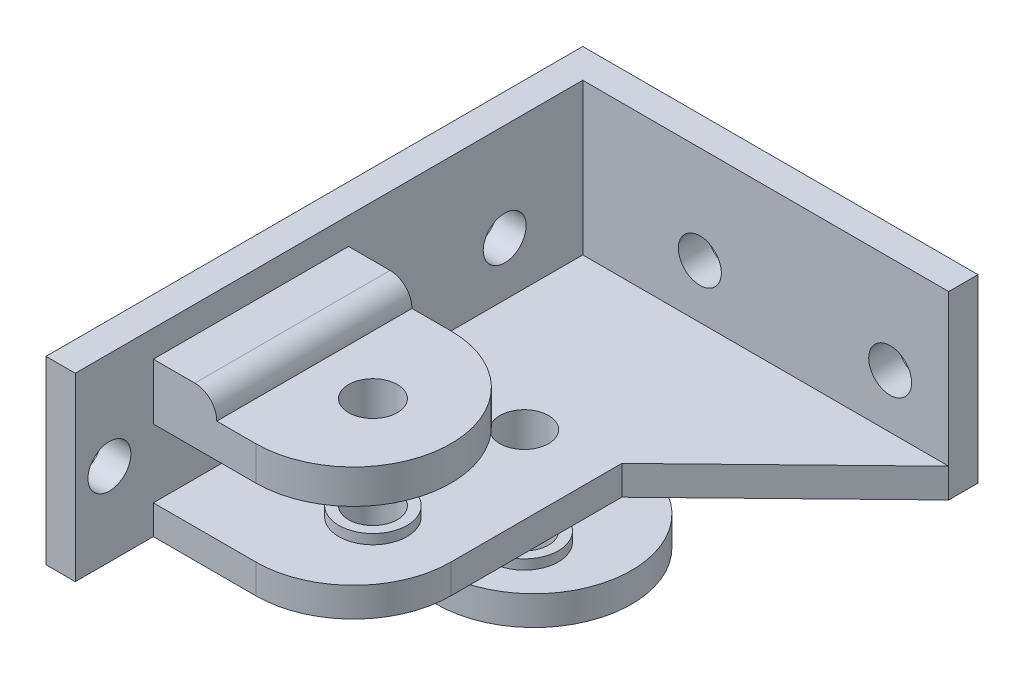
from build123d import *

# Parameters (mm, degrees)
BOSS_EXTRUDE1_DEPTH = 18.5
BOSS_EXTRUDE2_DEPTH = 3
BOSS_EXTRUDE3_START = 7
BOSS_EXTRUDE3_DEPTH = 3.5
SKETCH4_W           = 6.5
SKETCH4_H           = 2.25
BOSS_EXTRUDE4_DEPTH = 20
FILLET1_R           = 2.25
BOSS_EXTRUDE5_DEPTH = 7
BOSS_EXTRUDE6_DEPTH = 3
SKETCH7_R           = 2.5
CUT_EXTRUDE1_DEPTH  = 73.232264259
SKETCH8_R           = 2.2
CUT_EXTRUDE2_DEPTH  = 71.763691255
CUT_EXTRUDE3_REACH  = 72.764
SKETCH9_R           = 2.2
BOSS_EXTRUDE7_REACH = 74.907
SKETCH10_R          = 3.5
SKETCH10_R_2        = 2.5
BOSS_EXTRUDE8_REACH = 72.039
SKETCH11_R          = 3.5
SKETCH11_R_2        = 2.5
CUT_EXTRUDE4_REACH  = 66.742
SKETCH12_W          = 7
SKETCH12_H          = 5


with BuildPart() as part:
    # Sketch1 → Boss-Extrude1 (new body)
    with BuildSketch(Plane(origin=(0, 0, 0), x_dir=(1, 0, 0), z_dir=(0, 1, 0))):
        Polygon((40.5, 0), (0, 0), (0, -55), (3, -55), (3, -3), (40.5, -3), align=None)
    extrude(amount=BOSS_EXTRUDE1_DEPTH)

    # Sketch2 → Boss-Extrude2 (add)
    with BuildSketch(Plane.XZ):
        with BuildLine():
            Line((40.5, 3), (23.5, 19.5))
            Line((23.5, 19.5), (23.5, 37))
            ThreePointArc((23.5, 37), (20.571067812, 44.071067812), (13.5, 47))
            Line((13.5, 47), (3, 47))
            Line((3, 47), (3, 3))
            Line((3, 3), (40.5, 3))
        make_face()
    extrude(amount=-BOSS_EXTRUDE2_DEPTH)

    # Sketch3 → Boss-Extrude3 (add)
    with BuildSketch(Plane(origin=(0, 3, 0), x_dir=(1, 0, 0), z_dir=(0, 1, 0)).offset(BOSS_EXTRUDE3_START)):
        with BuildLine():
            Line((3, -47), (13.5, -47))
            ThreePointArc((13.5, -47), (23.5, -37), (13.5, -27))
            Line((13.5, -27), (3, -27))
            Line((3, -27), (3, -47))
        make_face()
    extrude(amount=BOSS_EXTRUDE3_DEPTH)

    # Sketch4 → Boss-Extrude4 (add)
    with BuildSketch(Plane.XY.offset(47)):
        with Locations((6.25, 14.625)):
            Rectangle(SKETCH4_W, SKETCH4_H)
    extrude(amount=-BOSS_EXTRUDE4_DEPTH)

    # Fillet1
    fillet1_edges = [part.edges().sort_by_distance(p)[0] for p in [
        (9.5, 15.75, 37),
    ]]
    fillet(fillet1_edges, radius=FILLET1_R - 0.0001)  # a hair under: the kernel refuses the full size

    # Sketch5 → Boss-Extrude5 (add)
    with BuildSketch(Plane.XZ):
        Polygon((0, 28.5), (0, 8.5), (9, 8.5), (9, 10.5), (3, 10.5), (3, 28.5), align=None)
    extrude(amount=BOSS_EXTRUDE5_DEPTH)

    # Sketch6 → Boss-Extrude6 (add)
    with BuildSketch(Plane.XZ.offset(7)):
        with BuildLine():
            Line((0, 8.5), (0, 28.5))
            Line((0, 28.5), (13.5, 28.5))
            ThreePointArc((13.5, 28.5), (23.5, 18.5), (13.5, 8.5))
            Line((13.5, 8.5), (0, 8.5))
        make_face()
    extrude(amount=BOSS_EXTRUDE6_DEPTH)

    # Sketch7 → Cut-Extrude1 (cut, through all)
    with BuildSketch(Plane(origin=(0, 13.5, 0), x_dir=(1, 0, 0), z_dir=(0, 1, 0))):
        with Locations(Location((15.5, -21.5, 0), (0, 0, 270))):
            Circle(SKETCH7_R)
        with Locations(Location((15.5, -37, 0), (0, 0, 270))):
            Circle(SKETCH7_R)
    extrude(amount=-CUT_EXTRUDE1_DEPTH, mode=Mode.SUBTRACT)

    # Sketch8 → Cut-Extrude2 (cut, through all)
    with BuildSketch(Plane.ZY):
        with Locations((11, 8.5)):
            Circle(SKETCH8_R)
        with Locations((51.5, 8.5)):
            Circle(SKETCH8_R)
    extrude(amount=-CUT_EXTRUDE2_DEPTH, mode=Mode.SUBTRACT)

    # Sketch9 → Cut-Extrude3 (cut, up to next)
    with BuildSketch(Plane(origin=(0, 0, 0), x_dir=(-1, 0, 0), z_dir=(0, 0, -1)), mode=Mode.PRIVATE) as cut_extrude3_sk1:
        with Locations((-34.5, 8.5)):
            Circle(SKETCH9_R)
    cut_extrude3_tool1 = extrude(cut_extrude3_sk1.sketch, amount=-CUT_EXTRUDE3_REACH, mode=Mode.PRIVATE) & part.part
    # Sketch9 → Cut-Extrude3 (cut, up to next)
    with BuildSketch(Plane(origin=(0, 0, 0), x_dir=(-1, 0, 0), z_dir=(0, 0, -1)), mode=Mode.PRIVATE) as cut_extrude3_sk2:
        with Locations((-15, 8.5)):
            Circle(SKETCH9_R)
    cut_extrude3_tool2 = extrude(cut_extrude3_sk2.sketch, amount=-CUT_EXTRUDE3_REACH, mode=Mode.PRIVATE) & part.part
    add(cut_extrude3_tool1.solids().sort_by_distance((34.5, 8.5, 0))[0], mode=Mode.SUBTRACT)
    add(cut_extrude3_tool2.solids().sort_by_distance((15, 8.5, 0))[0], mode=Mode.SUBTRACT)

    # Sketch10 → Boss-Extrude7 (add, up to next)
    with BuildSketch(Plane(origin=(0, -7, 0), x_dir=(1, 0, 0), z_dir=(0, 1, 0)), mode=Mode.PRIVATE) as boss_extrude7_sk1:
        with Locations(Location((15.5, -21.5, 0), (0, 0, 270))):
            Circle(SKETCH10_R)
        with Locations(Location((15.5, -21.5, 0), (0, 0, 270))):
            Circle(SKETCH10_R_2, mode=Mode.SUBTRACT)
    boss_extrude7_tool1 = extrude(boss_extrude7_sk1.sketch, amount=BOSS_EXTRUDE7_REACH, mode=Mode.PRIVATE) - part.part
    add(boss_extrude7_tool1.solids().sort_by_distance((15.5, -7, 18.098995))[0])

    # Sketch11 → Boss-Extrude8 (add, up to next)
    with BuildSketch(Plane(origin=(0, 3, 0), x_dir=(1, 0, 0), z_dir=(0, 1, 0)), mode=Mode.PRIVATE) as boss_extrude8_sk1:
        with Locations(Location((15.5, -37, 0), (0, 0, 90))):
            Circle(SKETCH11_R)
        with Locations(Location((15.5, -37, 0), (0, 0, 270))):
            Circle(SKETCH11_R_2, mode=Mode.SUBTRACT)
    boss_extrude8_tool1 = extrude(boss_extrude8_sk1.sketch, amount=BOSS_EXTRUDE8_REACH, mode=Mode.PRIVATE) - part.part
    add(boss_extrude8_tool1.solids().sort_by_distance((15.5, 3, 40.401005))[0])

    # Cut-Extrude4: up to this face of the body (flat: up to its plane)
    cut_extrude4_end = Plane(part.part.faces().sort_by_distance((21.584376674, 10.874217494, 3))[0])
    # Sketch12 → Cut-Extrude4 (cut, up to the picked face)
    with BuildSketch(Plane.XY.offset(47), mode=Mode.PRIVATE) as cut_extrude4_sk1:
        with Locations((15.5, -3.5)):
            Rectangle(SKETCH12_W, SKETCH12_H)
    cut_extrude4_tool1 = split(extrude(cut_extrude4_sk1.sketch, amount=-CUT_EXTRUDE4_REACH, mode=Mode.PRIVATE), bisect_by=cut_extrude4_end, keep=Keep.BOTH, mode=Mode.PRIVATE)
    # Sketch12 → Cut-Extrude4 (cut, up to the picked face)
    with BuildSketch(Plane.XY.offset(47), mode=Mode.PRIVATE) as cut_extrude4_sk2:
        with Locations((15.5, 6.5)):
            Rectangle(SKETCH12_W, SKETCH12_H)
    cut_extrude4_tool2 = split(extrude(cut_extrude4_sk2.sketch, amount=-CUT_EXTRUDE4_REACH, mode=Mode.PRIVATE), bisect_by=cut_extrude4_end, keep=Keep.BOTH, mode=Mode.PRIVATE)
    add(cut_extrude4_tool1.solids().sort_by(Axis((15.5, -3.5, 47), (0, 0, -1)))[0], mode=Mode.SUBTRACT)
    add(cut_extrude4_tool2.solids().sort_by(Axis((15.5, 6.5, 47), (0, 0, -1)))[0], mode=Mode.SUBTRACT)


solid = part.part
